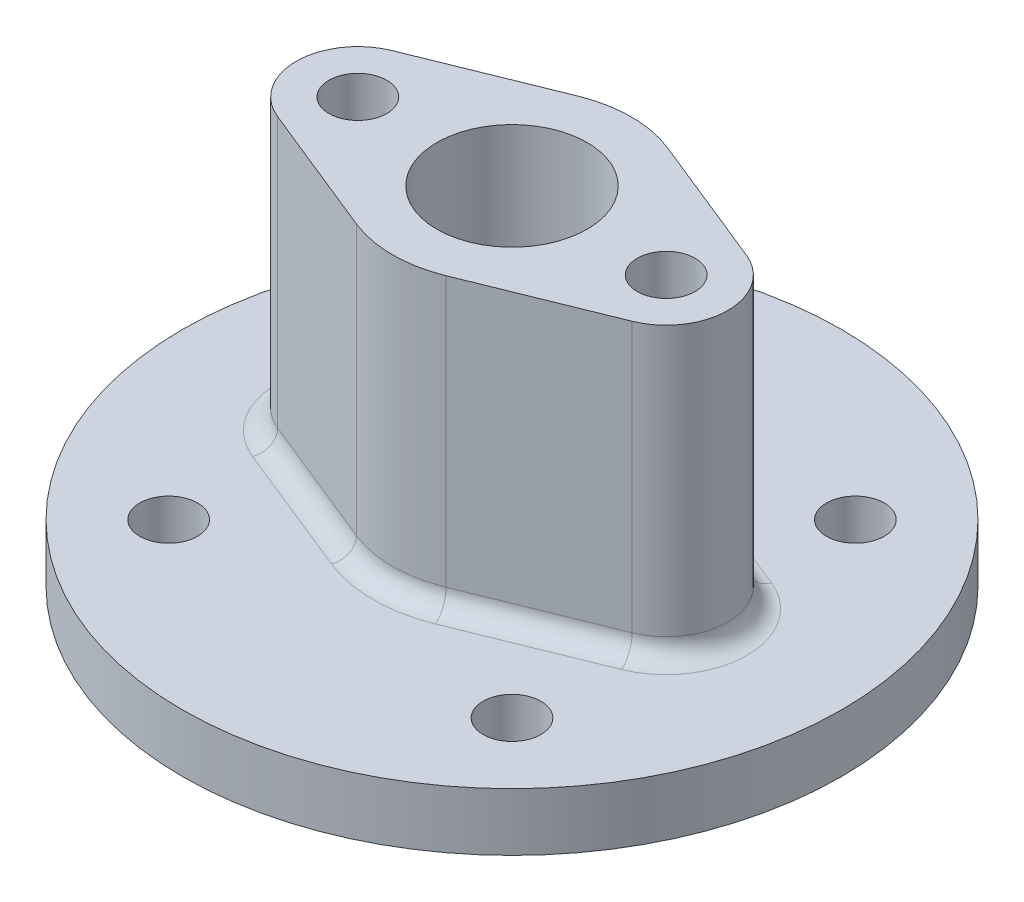
from build123d import *

# Parameters (mm, degrees)
SKETCH1_R                   = 7.5
SKETCH1_R_2                 = 19.5
SKETCH1_R_3                 = 10.5
BOSS_EXTRUDE1_DEPTH         = 75
SKETCH1_3_R                 = 85.5
SKETCH1_3_R_2               = 7.5
BOSS_EXTRUDE2_DEPTH         = 15
F_1_0MM_DOWEL_HOLE1_D       = 15
F_1_0MM_DOWEL_HOLE1_DEPTH   = 25.493545357
F_1_0MM_DOWEL_HOLE1_TIP     = 4.506454643
SKETCH4_R                   = 42
SKETCH5_R                   = 24
ADVANCEDHOLE1_START         = -57
ADVANCEDHOLE1_OUTLINE_R     = 10.5
ADVANCEDHOLE1_DEPTH         = 132
ADVANCEDHOLE1_START_2       = 45
ADVANCEDHOLE1_2_OUTLINE_R   = 19.5
ADVANCEDHOLE1_2_OUTLINE_R_2 = 10.5
ADVANCEDHOLE1_2_DEPTH       = 30
ADVANCEDHOLE1_START_3       = 9
ADVANCEDHOLE1_3_OUTLINE_R   = 19.5
ADVANCEDHOLE1_3_OUTLINE_R_2 = 10.5
ADVANCEDHOLE1_3_DEPTH       = 24
ADVANCEDHOLE1_4_OUTLINE_R   = 12
ADVANCEDHOLE1_4_OUTLINE_R_2 = 10.5
ADVANCEDHOLE1_4_DEPTH       = 66
FILLET1_R                   = 5


# Read off the part's stored shape, not the designer's step: AdvancedHole1
with BuildPart() as part:
    # Sketch1 → Boss-Extrude1 (new body)
    # profile 1 of 5: a face of its own
    with BuildSketch(Plane(origin=(0, 0, 0), x_dir=(1, 0, 0), z_dir=(0, 1, 0))):
        with BuildLine():
            Line((11.625, 28.737769137), (46, 14.832396974))
            ThreePointArc((46, 14.832396974), (56, 0), (46, -14.832396974))
            Line((46, -14.832396974), (11.625, -28.737769137))
            ThreePointArc((11.625, -28.737769137), (0, -31), (-11.625, -28.737769137))
            Line((-11.625, -28.737769137), (-46, -14.832396974))
            ThreePointArc((-46, -14.832396974), (-56, 0), (-46, 14.832396974))
            Line((-46, 14.832396974), (-11.625, 28.737769137))
            ThreePointArc((-11.625, 28.737769137), (0, 31), (11.625, 28.737769137))
        make_face()
        with Locations((-40, 0)):
            Circle(SKETCH1_R, mode=Mode.SUBTRACT)
        with Locations((40, 0)):
            Circle(SKETCH1_R, mode=Mode.SUBTRACT)
        Circle(SKETCH1_R_2, mode=Mode.SUBTRACT)
    # profile 2 of 5: a face of its own
    with BuildSketch(Plane(origin=(0, 0, 0), x_dir=(1, 0, 0), z_dir=(0, 1, 0))):
        Circle(SKETCH1_R_2)
        Circle(SKETCH1_R_3, mode=Mode.SUBTRACT)
    # profile 3 of 5: a face of its own
    with BuildSketch(Plane(origin=(0, 0, 0), x_dir=(1, 0, 0), z_dir=(0, 1, 0))):
        Circle(SKETCH1_R_3)
    # profile 4 of 5: a face of its own
    with BuildSketch(Plane(origin=(0, 0, 0), x_dir=(1, 0, 0), z_dir=(0, 1, 0))):
        with Locations((40, 0)):
            Circle(SKETCH1_R)
    # profile 5 of 5: a face of its own
    with BuildSketch(Plane(origin=(0, 0, 0), x_dir=(1, 0, 0), z_dir=(0, 1, 0))):
        with Locations((-40, 0)):
            Circle(SKETCH1_R)
    extrude(amount=BOSS_EXTRUDE1_DEPTH)

    # Sketch1<3> → Boss-Extrude2 (add)
    with BuildSketch(Plane(origin=(0, 0, 0), x_dir=(1, 0, 0), z_dir=(0, 1, 0))):
        with Locations(Location((0, 0, 0), (0, 0, 270))):
            Circle(SKETCH1_3_R)
        with Locations(Location((44.547727215, 44.547727215, 0), (0, 0, 270))):
            Circle(SKETCH1_3_R_2, mode=Mode.SUBTRACT)
        with Locations(Location((44.547727215, -44.547727215, 0), (0, 0, 270))):
            Circle(SKETCH1_3_R_2, mode=Mode.SUBTRACT)
        with Locations(Location((-44.547727215, -44.547727215, 0), (0, 0, 270))):
            Circle(SKETCH1_3_R_2, mode=Mode.SUBTRACT)
        with Locations(Location((-44.547727215, 44.547727215, 0), (0, 0, 270))):
            Circle(SKETCH1_3_R_2, mode=Mode.SUBTRACT)
    extrude(amount=-BOSS_EXTRUDE2_DEPTH)

    # Ø1.0mm Dowel Hole1
    with Locations(Plane(origin=(-40, 75, 0), x_dir=(0, 0, 1), z_dir=(0, 1, 0))):
        with Locations((0, 0), (0, 80)):
            Hole(F_1_0MM_DOWEL_HOLE1_D / 2, depth=F_1_0MM_DOWEL_HOLE1_DEPTH)
            with Locations((0, 0, -(F_1_0MM_DOWEL_HOLE1_DEPTH + F_1_0MM_DOWEL_HOLE1_TIP / 2))):  # 118° drill point
                Cone(0, F_1_0MM_DOWEL_HOLE1_D / 2, F_1_0MM_DOWEL_HOLE1_TIP, mode=Mode.SUBTRACT)

    # Sketch4 → Loft1 section 0
    with BuildSketch(Plane.XZ.offset(15)):
        Circle(SKETCH4_R)
    # Sketch5 → Loft1 section 1
    with BuildSketch(Plane(origin=(0, -57, 0), x_dir=(-1, 0, 0), z_dir=(0, -1, 0))):
        Circle(SKETCH5_R)
    loft()

    # AdvancedHole1 outline → AdvancedHole1 (cut)
    with BuildSketch(Plane(origin=(0, 0, 0), x_dir=(1, 0, 0), z_dir=(0, 1, 0)).offset(ADVANCEDHOLE1_START)):
        Circle(ADVANCEDHOLE1_OUTLINE_R)
    extrude(amount=ADVANCEDHOLE1_DEPTH, mode=Mode.SUBTRACT)

    # AdvancedHole1 2 outline → AdvancedHole1 2 (cut)
    with BuildSketch(Plane(origin=(0, 0, 0), x_dir=(1, 0, 0), z_dir=(0, 1, 0)).offset(ADVANCEDHOLE1_START_2)):
        Circle(ADVANCEDHOLE1_2_OUTLINE_R)
        Circle(ADVANCEDHOLE1_2_OUTLINE_R_2, mode=Mode.SUBTRACT)
    extrude(amount=ADVANCEDHOLE1_2_DEPTH, mode=Mode.SUBTRACT)

    # AdvancedHole1 3 outline → AdvancedHole1 3 (cut)
    with BuildSketch(Plane(origin=(0, 0, 0), x_dir=(1, 0, 0), z_dir=(0, 1, 0)).offset(ADVANCEDHOLE1_START_3)):
        Circle(ADVANCEDHOLE1_3_OUTLINE_R)
        Circle(ADVANCEDHOLE1_3_OUTLINE_R_2, mode=Mode.SUBTRACT)
    extrude(amount=ADVANCEDHOLE1_3_DEPTH, mode=Mode.SUBTRACT)

    # AdvancedHole1 4 outline → AdvancedHole1 4 (cut)
    with BuildSketch(Plane(origin=(0, 0, 0), x_dir=(1, 0, 0), z_dir=(0, 1, 0)).offset(ADVANCEDHOLE1_START)):
        Circle(ADVANCEDHOLE1_4_OUTLINE_R)
        Circle(ADVANCEDHOLE1_4_OUTLINE_R_2, mode=Mode.SUBTRACT)
    extrude(amount=ADVANCEDHOLE1_4_DEPTH, mode=Mode.SUBTRACT)

    # Fillet1
    fillet1_edges = [part.edges().sort_by_distance(p)[0] for p in [
        (28.8125, 0, 21.785083056),
        (0, 0, 31),
        (-28.8125, 0, 21.785083056),
        (-56, 0, 0),
        (-28.8125, 0, -21.785083056),
        (0, 0, -31),
        (28.8125, 0, -21.785083056),
        (56, 0, 0),
    ]]
    fillet(fillet1_edges, radius=FILLET1_R)


solid = part.part
